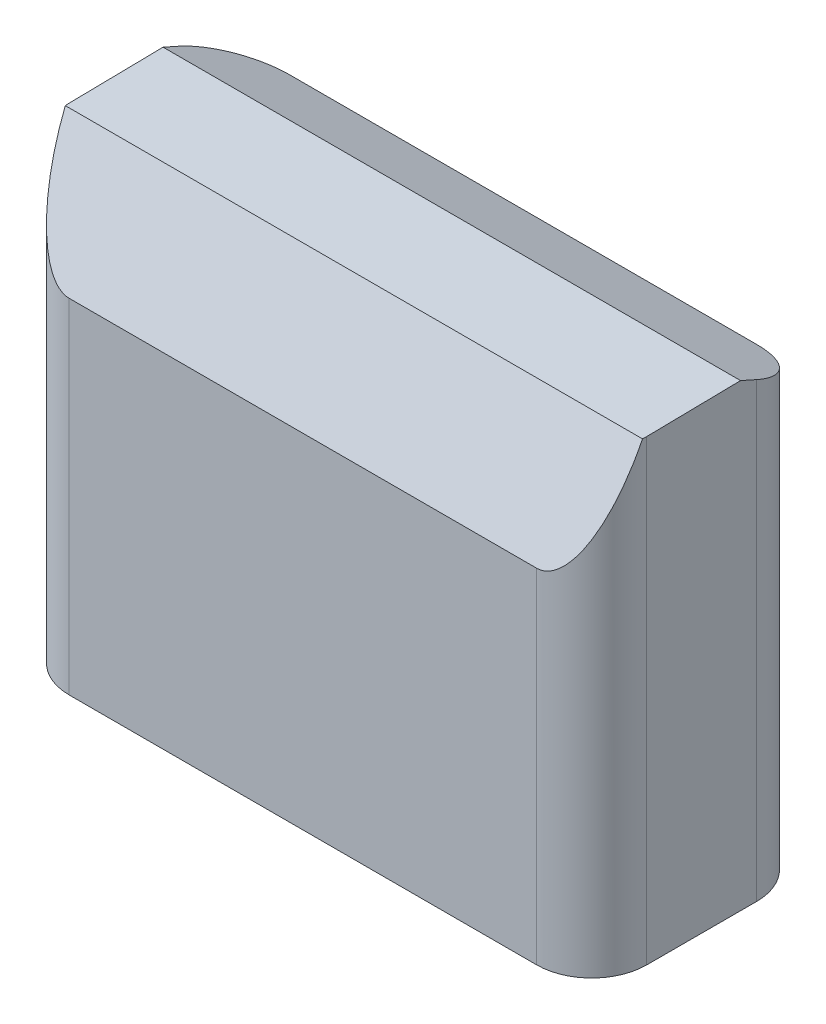
from build123d import *

# Parameters (mm, degrees)
SKETCH1_W           = 105
SKETCH1_H           = 90
BOSS_EXTRUDE1_DEPTH = 40
FILLET5_R           = 10.000000066
FILLET6_R           = 10.000000066
FILLET7_R           = 10.000000066
FILLET8_R           = 10.000000066
CHAMFER14_SIZE      = 27.54
CHAMFER14_SIZE_2    = 12.3
CHAMFER15_SIZE      = 415.05734945
CHAMFER15_SIZE_2    = 7.46


with BuildPart() as part:
    # Sketch1 → Boss-Extrude1 (new body)
    with BuildSketch(Plane.XY):
        with Locations((7.000234735, -13.857374392)):
            Rectangle(SKETCH1_W, SKETCH1_H)
    extrude(amount=BOSS_EXTRUDE1_DEPTH)

    # Fillet5
    fillet5_edges = [part.edges().sort_by_distance(p)[0] for p in [
        (59.500234735, -13.857374392, 40),
    ]]
    fillet(fillet5_edges, radius=FILLET5_R)

    # Fillet6
    fillet6_edges = [part.edges().sort_by_distance(p)[0] for p in [
        (-45.499765265, -13.857374392, 40),
    ]]
    fillet(fillet6_edges, radius=FILLET6_R)

    # Fillet7
    fillet7_edges = [part.edges().sort_by_distance(p)[0] for p in [
        (59.500234735, -13.857374392, 0),
    ]]
    fillet(fillet7_edges, radius=FILLET7_R)

    # Fillet8
    fillet8_edges = [part.edges().sort_by_distance(p)[0] for p in [
        (-45.499765265, -13.857374392, 0),
    ]]
    fillet(fillet8_edges, radius=FILLET8_R)

    # Chamfer14
    # the kernel refuses this chamfer: 27.54, 12.3 mm, written as the material it takes off along each edge
    with BuildSketch(Plane(origin=(-106.873201315, 31.142625608, 0), x_dir=(0, 0.015735241575877565, 0.99987619342224), z_dir=(1, 0, 0))) as chamfer14_piece_1:
        Polygon((CHAMFER14_SIZE * 0.999876193422, CHAMFER14_SIZE * 0.0157352415759), (-CHAMFER14_SIZE_2 * 0.0157352415759, CHAMFER14_SIZE_2 * 0.999876193422), (0, 0), align=None)
    extrude(amount=227.7468721, mode=Mode.SUBTRACT)
    with BuildSketch(Plane(origin=(-106.873201315, 31.142625608, 40), x_dir=(0, 0.07864976650804911, -0.9969023092701859), z_dir=(1, 0, 0))) as chamfer14_piece_2:
        Polygon((CHAMFER14_SIZE_2 * 0.99690230927, -CHAMFER14_SIZE_2 * 0.078649766508), (-CHAMFER14_SIZE * 0.078649766508, -CHAMFER14_SIZE * 0.99690230927), (0, 0), align=None)
    extrude(amount=227.7468721, mode=Mode.SUBTRACT)

    # Chamfer15
    # the kernel refuses this chamfer: 415.05734945, 7.46 mm, written as the material it takes off along each edge
    with BuildSketch(Plane(origin=(-1124.643578574, 31.142625608, 27.7), x_dir=(0, 0.0006265203958835344, -0.9999998037360776), z_dir=(1, 0, 0))) as chamfer15_piece_1:
        Polygon((CHAMFER15_SIZE * 0.999999803737, -CHAMFER15_SIZE * 0.000626520395884), (-CHAMFER15_SIZE_2 * 0.408370910279, -CHAMFER15_SIZE_2 * 0.912816082044), (0, 0), align=None)
    extrude(amount=2263.287626617, mode=Mode.SUBTRACT)


solid = part.part
